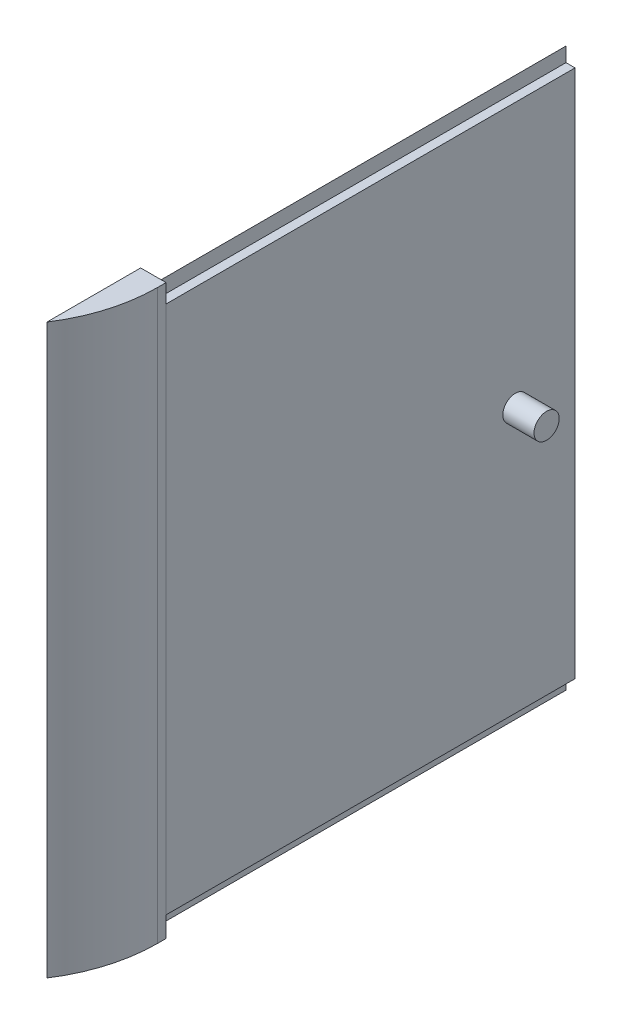
from build123d import *

# Parameters (mm, degrees)
BOSS_EXTRUDE1_DEPTH = 105
BOSS_EXTRUDE2_DEPTH = 24
FILLET1_R           = 40
SKETCH5_R           = 3.219097994
BOSS_EXTRUDE3_DEPTH = 8


with BuildPart() as part:
    # Sketch1 → Boss-Extrude1 (new body)
    with BuildSketch(Plane.XY):
        Polygon((37.434072543, -12), (37.434072543, -8.558894962), (33.934072543, -12.102644962), (33.934072543, -147.897355038), (37.434072543, -151.441105038), (37.434072543, -148), (37.434072543, -147.75), (37.684072543, -147.75), (39.75, -147.75), (39.75, -12.25), (37.684072543, -12.25), (37.434072543, -12.25), align=None)
    extrude(amount=-BOSS_EXTRUDE1_DEPTH)

    # Sketch4 → Boss-Extrude2 (add)
    with BuildSketch(Plane.XY):
        Polygon((40, -152.75), (33.5, -152.75), (33.5, -7.25), (40, -7.25), (40, -80), align=None)
    extrude(amount=BOSS_EXTRUDE2_DEPTH)

    # Fillet1
    # the kernel refuses this fillet: 40 mm, written as the material it takes off along each edge
    with BuildSketch(Plane(origin=(40, 47.393732486, 24), x_dir=(0, 0, -1), z_dir=(0, -1, 0))) as fillet1_piece_1:
        with BuildLine():
            CenterArc((21.857492994, -40), FILLET1_R, 90, 33.122940208)
            Line((0, -6.5), (0, 0))
            Line((0, 0), (21.857492994, 0))
        make_face()
    extrude(amount=254.787464972, mode=Mode.SUBTRACT)

    # Sketch5 → Boss-Extrude3 (add)
    with BuildSketch(Plane(origin=(39.75, 0, 0), x_dir=(0, 0, -1), z_dir=(1, 0, 0))):
        with Locations((89.714756259, -80)):
            Circle(SKETCH5_R)
    extrude(amount=BOSS_EXTRUDE3_DEPTH)


solid = part.part
